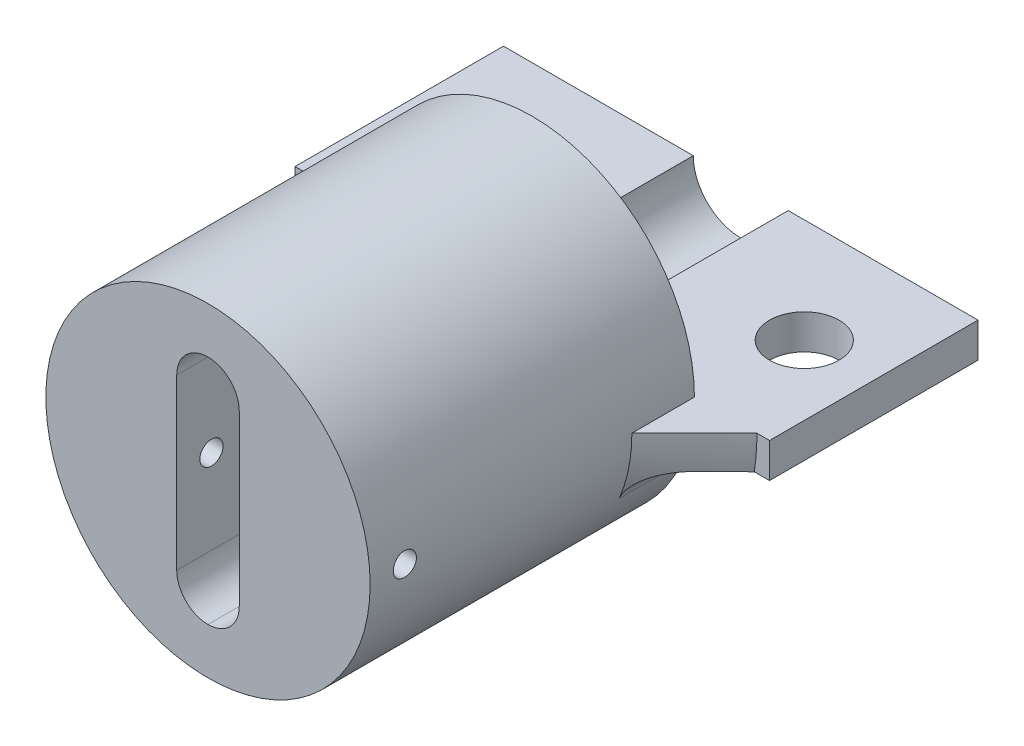
from build123d import *

# Parameters (mm, degrees)
SKETCH1_R           = 7
BOSS_EXTRUDE1_DEPTH = 4
SKETCH2_R           = 7
SKETCH2_R_2         = 5
BOSS_EXTRUDE2_DEPTH = 10
BOSS_EXTRUDE3_DEPTH = 10
BOSS_EXTRUDE4_DEPTH = 9
FILLET3_R           = 1.35
CHAMFER1_SIZE       = 2.7
SKETCH7_R           = 1.5
CUT_EXTRUDE1_DEPTH  = 10
FILLET4_R           = 2
SKETCH8_R           = 0.5
CUT_EXTRUDE2_DEPTH  = 25.534299997


# Some blends are built 0.0001 mm under size
with BuildPart() as part:
    # Sketch1 → Boss-Extrude1 (new body)
    with BuildSketch(Plane.XY):
        Circle(SKETCH1_R)
    extrude(amount=BOSS_EXTRUDE1_DEPTH)

    # Sketch2 → Boss-Extrude2 (add)
    with BuildSketch(Plane.XY.offset(4)):
        Circle(SKETCH2_R)
        Circle(SKETCH2_R_2, mode=Mode.SUBTRACT)
    extrude(amount=BOSS_EXTRUDE2_DEPTH)

    # Sketch3 → Boss-Extrude3 (add)
    with BuildSketch(Plane.XY.offset(4)):
        with BuildLine():
            Line((-1.35, 4.814301611), (-1.35, -4.814301611))
            ThreePointArc((-1.35, -4.814301611), (-5, 0), (-1.35, 4.814301611))
        make_face()
        with BuildLine():
            Line((1.35, 4.814301611), (1.35, -4.814301611))
            ThreePointArc((1.35, -4.814301611), (5, 0), (1.35, 4.814301611))
        make_face()
    extrude(amount=BOSS_EXTRUDE3_DEPTH)

    # Sketch4 → Boss-Extrude4 (add)
    with BuildSketch(Plane(origin=(0, 0, 0), x_dir=(-1, 0, 0), z_dir=(0, 0, -1))):
        with BuildLine():
            Line((2.05, 0), (4.242640687, 0))
            Line((4.242640687, 0), (10.242640687, 0))
            Line((10.242640687, 0), (10.242640687, -1.5))
            Line((10.242640687, -1.5), (4.242640687, -1.5))
            ThreePointArc((4.242640687, -1.5), (0, -4.5), (-4.242640687, -1.5))
            Line((-4.242640687, -1.5), (-10.242640687, -1.5))
            Line((-10.242640687, -1.5), (-10.242640687, 0))
            Line((-10.242640687, 0), (-4.242640687, 0))
            Line((-4.242640687, 0), (-2.05, 0))
            ThreePointArc((-2.05, 0), (0, -2.05), (2.05, 0))
        make_face()
    extrude(amount=BOSS_EXTRUDE4_DEPTH)

    # Fillet3
    fillet3_edges = [part.edges().sort_by_distance(p)[0] for p in [
        (-1.35, 4.814301611, 9),
    ]]
    fillet(fillet3_edges, radius=FILLET3_R)
    fillet3_2_edges = [part.edges().sort_by_distance(p)[0] for p in [
        (1.35, 4.814301611, 9),
    ]]
    fillet(fillet3_2_edges, radius=FILLET3_R - 0.0001)  # a hair under: the kernel refuses the full size
    fillet3_3_edges = [part.edges().sort_by_distance(p)[0] for p in [
        (1.35, -4.814301611, 9),
    ]]
    fillet(fillet3_3_edges, radius=FILLET3_R)
    fillet3_4_edges = [part.edges().sort_by_distance(p)[0] for p in [
        (-1.35, -4.814301611, 9),
    ]]
    fillet(fillet3_4_edges, radius=FILLET3_R - 0.0001)  # a hair under: the kernel refuses the full size
    fillet3_5_edges = [part.edges().sort_by_distance(p)[0] for p in [
        (-1.35, -4.9999e-05, 4),
    ]]
    fillet(fillet3_5_edges, radius=FILLET3_R - 0.0001)  # a hair under: the kernel refuses the full size

    # Chamfer1
    # the kernel refuses this chamfer: 2.7 mm, written as the material it adds along each edge
    with BuildSketch(Plane(origin=(0, 0, 0), x_dir=(-1, 0, 0), z_dir=(0, 1, 0))) as chamfer1_piece_1_section:
        Polygon((7, CHAMFER1_SIZE), (7 + CHAMFER1_SIZE, 0), (7, 0), align=None)
    chamfer1_piece_1 = revolve(axis=Axis((0, 0, 0), (0, 0, 1)), revolution_arc=69.20773796, mode=Mode.PRIVATE)
    chamfer1_piece_1 = split(chamfer1_piece_1, bisect_by=Plane(origin=(-7.851109484, -1.5, 0.900303531), z_dir=(0, 1, 0)), keep=Keep.TOP, mode=Mode.PRIVATE)
    add(chamfer1_piece_1)
    with BuildSketch(Plane(origin=(0, 0, 0), x_dir=(0.3549807082679851, -0.9348736260894087, 0), z_dir=(-0.9348736260894087, -0.3549807082679851, 0))) as chamfer1_piece_2_section:
        Polygon((7, CHAMFER1_SIZE), (7 + CHAMFER1_SIZE, 0), (7, 0), align=None)
    chamfer1_piece_2 = revolve(axis=Axis((0, 0, 0), (0, 0, 1)), revolution_arc=69.20773796, mode=Mode.PRIVATE)
    chamfer1_piece_2 = split(chamfer1_piece_2, bisect_by=Plane(origin=(7.851109484, -1.5, 0.900303531), z_dir=(0, 1, 0)), keep=Keep.TOP, mode=Mode.PRIVATE)
    add(chamfer1_piece_2)

    # Sketch7 → Cut-Extrude1 (cut)
    with BuildSketch(Plane(origin=(0, 0, 0), x_dir=(1, 0, 0), z_dir=(0, 1, 0))):
        with Locations(Location((7.242640687, 4.5, 0), (0, 0, 180))):
            Circle(SKETCH7_R)
        with Locations(Location((-7.242640687, 4.5, 0), (0, 0, 180))):
            Circle(SKETCH7_R)
    extrude(amount=-CUT_EXTRUDE1_DEPTH, mode=Mode.SUBTRACT)

    # Fillet4
    fillet4_edges = [part.edges().sort_by_distance(p)[0] for p in [
        (-6.837397166, -1.5, 1.35),
        (6.837397166, -1.5, 1.35),
        (-5.540018926, -1.5, 0),
        (5.540018926, -1.5, 0),
        (0, -4.5, 0),
    ]]
    fillet(fillet4_edges, radius=FILLET4_R)

    # Sketch8 → Cut-Extrude2 (cut, through all)
    with BuildSketch(Plane(origin=(8.65, 0, 0), x_dir=(0, 0, -1), z_dir=(1, 0, 0))):
        with Locations((-12.5, 0)):
            Circle(SKETCH8_R)
    extrude(amount=-CUT_EXTRUDE2_DEPTH, mode=Mode.SUBTRACT)


solid = part.part
